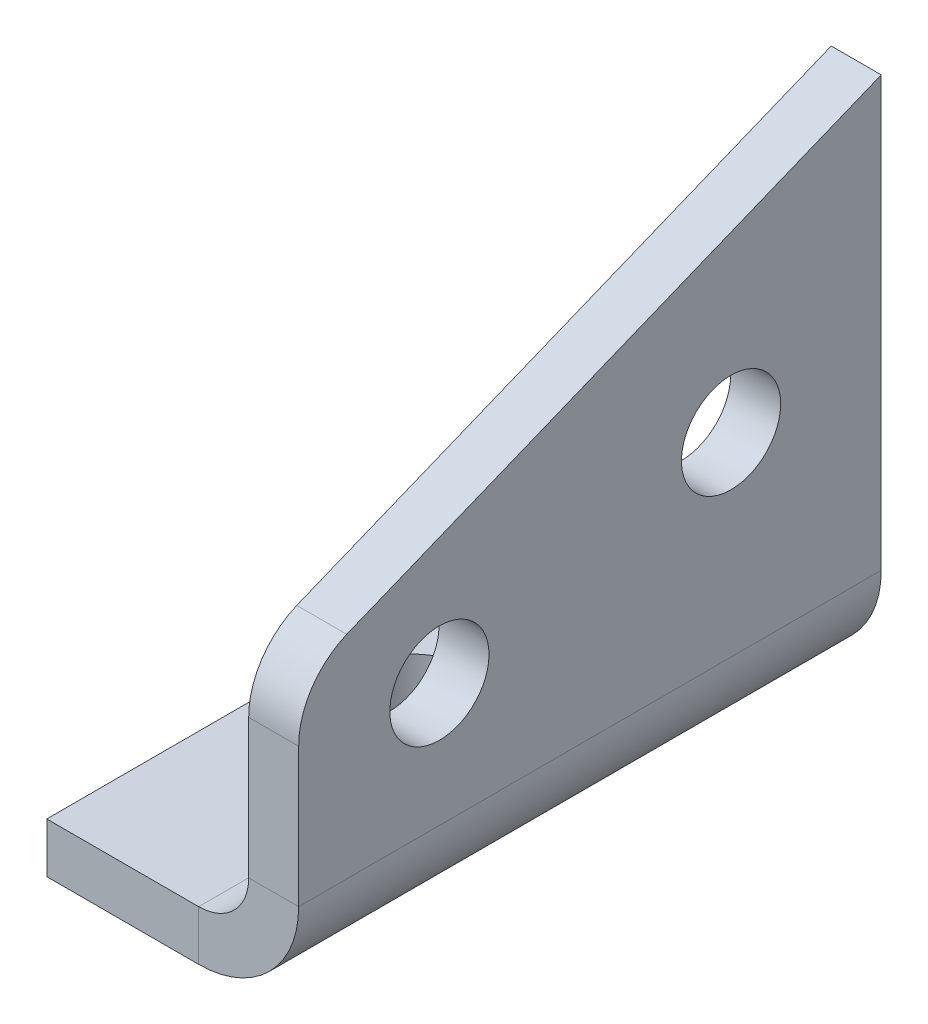
from build123d import *

# Parameters (mm, degrees)
SKETCH2_R                    = 3.15
BASE_FLANGE1_DEPTH           = 3.175
EDGE_FLANGE1_STRIP_W         = 20.85
EDGE_FLANGE1_STRIP_H         = 3.175
EDGE_FLANGE1_STRIP_CUT_DEPTH = 37
EDGE_FLANGE1_DEPTH           = 37
SKETCH10_R                   = 3.15
CUT_EXTRUDE1_DEPTH           = 10


# Sheet-metal steps are written as plain solids
with BuildPart() as part:
    # Sketch2 → Base-Flange1 (new body)
    with BuildSketch(Plane(origin=(0, 0, 0), x_dir=(0, 0, -1), z_dir=(1, 0, 0))):
        with BuildLine():
            Line((48.551064785, 40.291218586), (48.551064785, 72.093066751))
            Line((48.551064785, 72.093066751), (14.602650648, 58.297559694))
            ThreePointArc((14.602650648, 58.297559694), (12.37556545, 56.443388888), (11.551064785, 53.665249851))
            Line((11.551064785, 53.665249851), (11.551064785, 40.291218586))
            Line((11.551064785, 40.291218586), (48.551064785, 40.291218586))
        make_face()
        with Locations((39.011220588, 57.194773579)):
            Circle(SKETCH2_R, mode=Mode.SUBTRACT)
        with Locations((20.490203266, 52.672523101)):
            Circle(SKETCH2_R, mode=Mode.SUBTRACT)
    extrude(amount=-BASE_FLANGE1_DEPTH)

    # Edge-Flange1 strip (across the edge) → Edge-Flange1 strip cut (cut)
    with BuildSketch(Plane(origin=(-3.175, 38.491218586, -48.551064785), x_dir=(0, 1, 0), z_dir=(0, 0, 1))):
        with Locations((-4.075, -1.5875)):
            Rectangle(EDGE_FLANGE1_STRIP_W, EDGE_FLANGE1_STRIP_H)
    extrude(amount=EDGE_FLANGE1_STRIP_CUT_DEPTH, mode=Mode.SUBTRACT)

    # Edge-Flange1 section (across the edge) → Edge-Flange1 (add)
    with BuildSketch(Plane(origin=(-3.175, 38.491218586, -48.551064785), x_dir=(0, 1, 0), z_dir=(0, 0, 1))):
        with BuildLine():
            Line((0, 3.175), (0, 12.825))
            Line((0, 12.825), (3.175, 12.825))
            Line((3.175, 12.825), (3.175, 3.175))
            ThreePointArc((3.175, 3.175), (4.10493597, 0.92993597), (6.35, 0))
            Line((6.35, 0), (6.35, -3.175))
            ThreePointArc((6.35, -3.175), (1.859871939, -1.315128061), (0, 3.175))
        make_face()
    extrude(amount=EDGE_FLANGE1_DEPTH)

    # Sketch10 → Cut-Extrude1 (cut)
    with BuildSketch(Plane(origin=(0, 41.666218586, 0), x_dir=(1, 0, 0), z_dir=(0, 1, 0))):
        with Locations(Location((-11.175, 30.051064785, 0), (0, 0, 180))):
            Circle(SKETCH10_R)
    extrude(amount=-CUT_EXTRUDE1_DEPTH, mode=Mode.SUBTRACT)


solid = part.part
